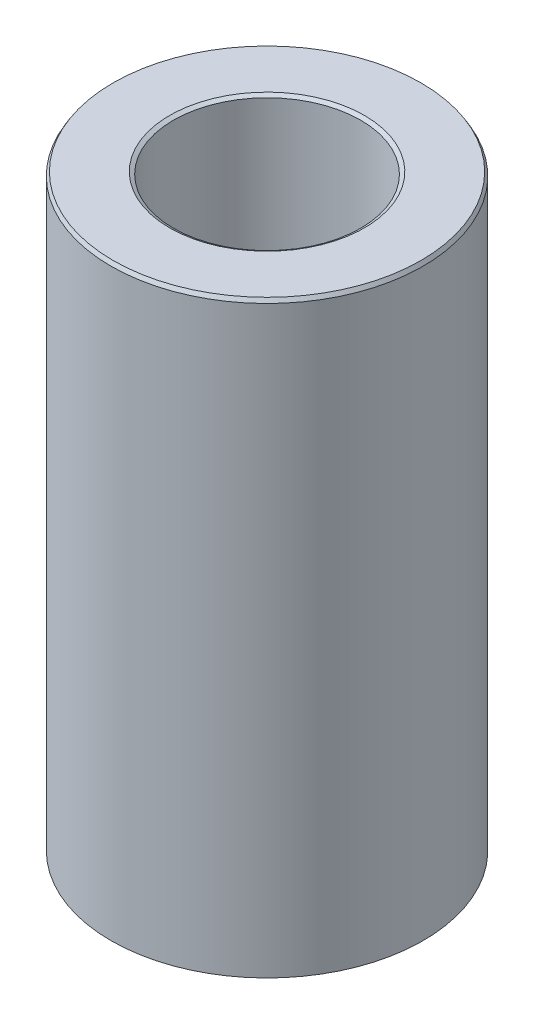
from build123d import *
from OCP.BRepFilletAPI import BRepFilletAPI_MakeChamfer

# Parameters (mm, degrees)
SKETCH1_R           = 47.5
BOSS_EXTRUDE1_DEPTH = 179.573982161
SKETCH2_R           = 28.490008609
CUT_EXTRUDE1_DEPTH  = 192.727189176
CHAMFER1_SIZE       = 1.157417738
CHAMFER1_SIZE2      = 0.668235443


with BuildPart() as part:
    # Sketch1 → Boss-Extrude1 (new body)
    with BuildSketch(Plane(origin=(0, 0, 0), x_dir=(1, 0, 0), z_dir=(0, 1, 0))):
        Circle(SKETCH1_R)
    extrude(amount=BOSS_EXTRUDE1_DEPTH)

    # Sketch2 → Cut-Extrude1 (cut, through all)
    with BuildSketch(Plane(origin=(0, 0, 0), x_dir=(1, 0, 0), z_dir=(0, 1, 0))):
        Circle(SKETCH2_R)
    extrude(amount=CUT_EXTRUDE1_DEPTH, mode=Mode.SUBTRACT)

    # Chamfer1: one chamfer whose edges measure the first distance from different faces: ONE call of the kernel's chamfer builder (chamfer() names one face for all edges)
    chamfer1_edges_1 = [part.edges().sort_by_distance(p)[0] for p in [
        (-28.490008609, 179.573982161, 0),
    ]]
    chamfer1_side_1 = [part.faces().sort_by_distance(p)[0] for p in [
        (-46.156497116, 179.573982161, 0),
    ]]
    chamfer1_edges_2 = [part.edges().sort_by_distance(p)[0] for p in [
        (-28.490008609, 0, 0),
    ]]
    chamfer1_side_2 = [part.faces().sort_by_distance(p)[0] for p in [
        (-28.490008609, 89.786991081, 0),
    ]]
    chamfer1_edges_3 = [part.edges().sort_by_distance(p)[0] for p in [
        (-47.5, 0, 0),
    ]]
    chamfer1_side_3 = [part.faces().sort_by_distance(p)[0] for p in [
        (-46.156497116, 0, 0),
    ]]
    chamfer1_edges_4 = [part.edges().sort_by_distance(p)[0] for p in [
        (-47.5, 179.573982161, 0),
    ]]
    chamfer1_side_4 = [part.faces().sort_by_distance(p)[0] for p in [
        (-47.5, 89.786991081, 0),
    ]]
    chamfer1 = BRepFilletAPI_MakeChamfer(part.part.solid().wrapped)
    for e in chamfer1_edges_1:
        chamfer1.Add(CHAMFER1_SIZE, CHAMFER1_SIZE2, e.wrapped, chamfer1_side_1[0].wrapped)  # the first distance lies on this face
    for e in chamfer1_edges_2:
        chamfer1.Add(CHAMFER1_SIZE, CHAMFER1_SIZE2, e.wrapped, chamfer1_side_2[0].wrapped)  # the first distance lies on this face
    for e in chamfer1_edges_3:
        chamfer1.Add(CHAMFER1_SIZE, CHAMFER1_SIZE2, e.wrapped, chamfer1_side_3[0].wrapped)  # the first distance lies on this face
    for e in chamfer1_edges_4:
        chamfer1.Add(CHAMFER1_SIZE, CHAMFER1_SIZE2, e.wrapped, chamfer1_side_4[0].wrapped)  # the first distance lies on this face
    add(Compound.cast(chamfer1.Shape()), mode=Mode.REPLACE)


solid = part.part
